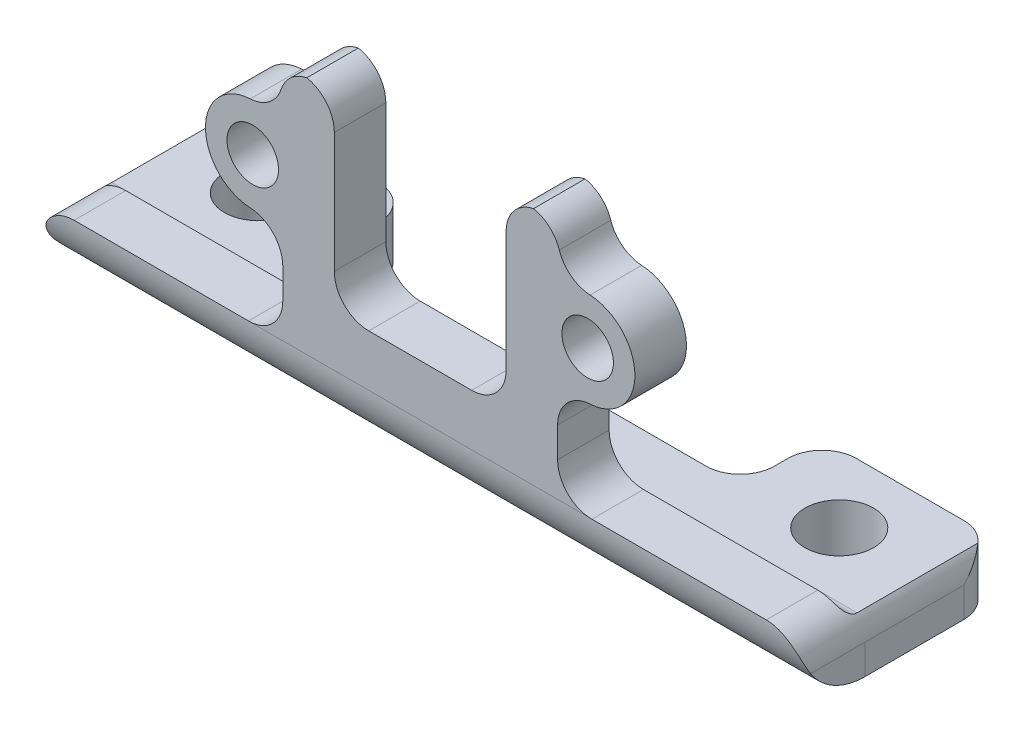
from build123d import *

# Parameters (mm, degrees)
ESBO_O23_W                     = 44.3
ESBO_O23_H                     = 11.5
ESBO_O23_R                     = 2
FLANGE_BASE2_DEPTH             = 3
ARESTA_FLANGE1_STRIP_W         = 13.4732
ARESTA_FLANGE1_STRIP_H         = 3
ARESTA_FLANGE1_STRIP_CUT_DEPTH = 44.3
ARESTA_FLANGE1_DEPTH           = 44.3
CORTE_EXTRUS_O1_REACH          = 41.939
CORTE_EXTRUS_O2_REACH          = 41.939
ESBO_O33_R                     = 1.5
ESBO_O33_W                     = 10
ESBO_O33_H                     = 11.0034
FILETE1_START                  = -5
FILETE1_DEPTH                  = 12.011168151
FILETE1_START_2                = 4.011168151
FILETE1_2_DEPTH                = 3
FILETE1_3_DEPTH                = 3
FILETE1_START_3                = -4
FILETE1_4_DEPTH                = 4.7366001
ESBO_O34_W                     = 23.8
ESBO_O34_H                     = 4.7634
CORTE_EXTRUS_O3_DEPTH          = 39.884804768
FILETE2_R                      = 2


with BuildPart() as part:
    # Flange-base2: sheet metal written as solids
    # Esboço23 → Flange-base2 (new body)
    with BuildSketch(Plane(origin=(0, 0, 0), x_dir=(1, 0, 0), z_dir=(0, 1, 0))):
        with Locations((13.143114832, -1.261168151)):
            Rectangle(ESBO_O23_W, ESBO_O23_H)
        with Locations(Location((-3.756885168, 0.488831849, 0), (0, 0, 270))):
            Circle(ESBO_O23_R, mode=Mode.SUBTRACT)
        with Locations(Location((30.043114832, 0.488831849, 0), (0, 0, 90))):
            Circle(ESBO_O23_R, mode=Mode.SUBTRACT)
    extrude(amount=-FLANGE_BASE2_DEPTH)

    # Aresta-Flange1: sheet metal written as solids
    # Aresta-Flange1 strip (on a plane across the edge) → Aresta-Flange1 strip cut (cut)
    with BuildSketch(Plane(origin=(-9.006885168, 0, 7.011168151), x_dir=(0, 0, -1), z_dir=(1, 0, 0))):
        with Locations((-3, -1.5)):
            Rectangle(ARESTA_FLANGE1_STRIP_W, ARESTA_FLANGE1_STRIP_H)
    extrude(amount=ARESTA_FLANGE1_STRIP_CUT_DEPTH, mode=Mode.SUBTRACT)

    # Aresta-Flange1 section (on a plane across the edge) → Aresta-Flange1 (add)
    with BuildSketch(Plane(origin=(-9.006885168, 0, 7.011168151), x_dir=(0, 0, -1), z_dir=(1, 0, 0))):
        with BuildLine():
            Line((0, 0.7366), (0, 14.74))
            Line((0, 14.74), (3, 14.74))
            Line((3, 14.74), (3, 0.7366))
            ThreePointArc((3, 0.7366), (3.215745145, 0.215745145), (3.7366, 0))
            Line((3.7366, 0), (3.7366, -3))
            ThreePointArc((3.7366, -3), (1.094424801, -1.905575199), (0, 0.7366))
        make_face()
    extrude(amount=ARESTA_FLANGE1_DEPTH)

    # Esboço31 → Corte-extrusão1 (cut, up to next)
    with BuildSketch(Plane.XY.offset(7.011168151), mode=Mode.PRIVATE) as corte_extrus_o1_sk1:
        with BuildLine():
            Line((5.143114832, 14.74), (5.143114832, 11.99))
            Line((5.143114832, 11.99), (3.393114832, 11.99))
            ThreePointArc((3.393114832, 11.99), (0.641414832, 9.2383), (3.393114832, 6.4866))
            Line((3.393114832, 6.4866), (5.143114832, 6.4866))
            Line((5.143114832, 6.4866), (5.143114832, 0.7366))
            Line((5.143114832, 0.7366), (-9.006885168, 0.7366))
            Line((-9.006885168, 0.7366), (-9.006885168, 14.74))
            Line((-9.006885168, 14.74), (5.143114832, 14.74))
        make_face()
    corte_extrus_o1_tool1 = extrude(corte_extrus_o1_sk1.sketch, amount=-CORTE_EXTRUS_O1_REACH, mode=Mode.PRIVATE) & part.part
    # Esboço31 → Corte-extrusão1 (cut, up to next)
    with BuildSketch(Plane.XY.offset(7.011168151), mode=Mode.PRIVATE) as corte_extrus_o1_sk2:
        with BuildLine():
            Line((21.143114832, 6.4866), (21.143114832, 0.7366))
            Line((21.143114832, 0.7366), (35.293114832, 0.7366))
            Line((35.293114832, 0.7366), (35.293114832, 14.74))
            Line((35.293114832, 14.74), (21.143114832, 14.74))
            Line((21.143114832, 14.74), (21.143114832, 11.99))
            Line((21.143114832, 11.99), (22.893114832, 11.99))
            ThreePointArc((22.893114832, 11.99), (25.644814832, 9.2383), (22.893114832, 6.4866))
            Line((22.893114832, 6.4866), (21.143114832, 6.4866))
        make_face()
    corte_extrus_o1_tool2 = extrude(corte_extrus_o1_sk2.sketch, amount=-CORTE_EXTRUS_O1_REACH, mode=Mode.PRIVATE) & part.part
    add(corte_extrus_o1_tool1.solids().sort_by_distance((-2.549902, 7.555498, 7.011168))[0], mode=Mode.SUBTRACT)
    add(corte_extrus_o1_tool2.solids().sort_by_distance((28.836132, 7.555498, 7.011168))[0], mode=Mode.SUBTRACT)

    # Esboço33 → Corte-extrusão2 (cut, up to next)
    with BuildSketch(Plane.XY.offset(7.011168151), mode=Mode.PRIVATE) as corte_extrus_o2_sk1:
        with Locations((3.393114832, 9.2383)):
            Circle(ESBO_O33_R)
    corte_extrus_o2_tool1 = extrude(corte_extrus_o2_sk1.sketch, amount=-CORTE_EXTRUS_O2_REACH, mode=Mode.PRIVATE) & part.part
    # Esboço33 → Corte-extrusão2 (cut, up to next)
    with BuildSketch(Plane.XY.offset(7.011168151), mode=Mode.PRIVATE) as corte_extrus_o2_sk2:
        with Locations(Location((22.893114832, 9.2383, 0), (0, 0, 180))):
            Circle(ESBO_O33_R)
    corte_extrus_o2_tool2 = extrude(corte_extrus_o2_sk2.sketch, amount=-CORTE_EXTRUS_O2_REACH, mode=Mode.PRIVATE) & part.part
    # Esboço33 → Corte-extrusão2 (cut, up to next)
    with BuildSketch(Plane.XY.offset(7.011168151), mode=Mode.PRIVATE) as corte_extrus_o2_sk3:
        with Locations((13.143114832, 9.2383)):
            Rectangle(ESBO_O33_W, ESBO_O33_H)
    corte_extrus_o2_tool3 = extrude(corte_extrus_o2_sk3.sketch, amount=-CORTE_EXTRUS_O2_REACH, mode=Mode.PRIVATE) & part.part
    add(corte_extrus_o2_tool1.solids().sort_by_distance((3.393115, 9.2383, 7.011168))[0], mode=Mode.SUBTRACT)
    add(corte_extrus_o2_tool2.solids().sort_by_distance((22.893115, 9.2383, 7.011168))[0], mode=Mode.SUBTRACT)
    add(corte_extrus_o2_tool3.solids().sort_by_distance((13.143115, 9.2383, 7.011168))[0], mode=Mode.SUBTRACT)

    # Filete1: read off the stored shape, not the designer's step
    # Filete1 outline → Filete1 (cut)
    with BuildSketch(Plane.XY.offset(FILETE1_START)):
        with BuildLine():
            Line((-9.006885168, 0.7366), (-9.006885168, -1.2634))
            ThreePointArc((-9.006885168, -1.2634), (-8.42109873, 0.150813562), (-7.006885168, 0.7366))
            Line((-7.006885168, 0.7366), (-9.006885168, 0.7366))
        make_face()
        with BuildLine():
            ThreePointArc((33.293114832, 0.7366), (34.707328395, 0.150813562), (35.293114832, -1.2634))
            Line((35.293114832, -1.2634), (35.293114832, 0.7366))
            Line((35.293114832, 0.7366), (33.293114832, 0.7366))
        make_face()
    extrude(amount=FILETE1_DEPTH, mode=Mode.SUBTRACT)

    # Filete1 2 outline → Filete1 2 (add)
    with BuildSketch(Plane.XY.offset(FILETE1_START_2)):
        with BuildLine():
            ThreePointArc((5.143114832, 2.7366), (4.557328394, 1.322386438), (3.143114832, 0.7366))
            Line((3.143114832, 0.7366), (5.143114832, 0.7366))
            Line((5.143114832, 0.7366), (5.143114832, 2.7366))
        make_face()
        with BuildLine():
            Line((21.143114832, 0.7366), (23.143114832, 0.7366))
            ThreePointArc((23.143114832, 0.7366), (21.72890127, 1.322386438), (21.143114832, 2.7366))
            Line((21.143114832, 2.7366), (21.143114832, 0.7366))
        make_face()
        with BuildLine():
            Line((8.143114832, 3.7366), (10.143114832, 3.7366))
            ThreePointArc((10.143114832, 3.7366), (8.72890127, 4.322386438), (8.143114832, 5.7366))
            Line((8.143114832, 5.7366), (8.143114832, 3.7366))
        make_face()
        with BuildLine():
            ThreePointArc((18.143114832, 5.7366), (17.557328394, 4.322386437), (16.143114832, 3.7366))
            Line((16.143114832, 3.7366), (18.143114832, 3.7366))
            Line((18.143114832, 3.7366), (18.143114832, 5.7366))
        make_face()
    extrude(amount=FILETE1_2_DEPTH)

    # Filete1 3 outline → Filete1 3 (add)
    with BuildSketch(Plane.XY.offset(FILETE1_START_2)):
        with BuildLine():
            ThreePointArc((22.893114832, 11.99), (22.96552716, 11.989047052), (23.037889334, 11.986188868))
            ThreePointArc((23.037889334, 11.986188868), (21.69217531, 12.606910766), (21.143114832, 13.983418849))
            Line((21.143114832, 13.983418849), (21.143114832, 11.99))
            Line((21.143114832, 11.99), (22.893114832, 11.99))
        make_face()
        with BuildLine():
            ThreePointArc((21.143114832, 4.493181151), (21.69217531, 5.869689234), (23.037889334, 6.490411131))
            ThreePointArc((23.037889334, 6.490411131), (22.96552716, 6.487552948), (22.893114832, 6.4866))
            Line((22.893114832, 6.4866), (21.143114832, 6.4866))
            Line((21.143114832, 6.4866), (21.143114832, 4.493181151))
        make_face()
        with BuildLine():
            ThreePointArc((5.143114832, 13.983418849), (4.594054355, 12.606910766), (3.248340331, 11.986188869))
            ThreePointArc((3.248340331, 11.986188869), (3.320702504, 11.989047052), (3.393114832, 11.99))
            Line((3.393114832, 11.99), (5.143114832, 11.99))
            Line((5.143114832, 11.99), (5.143114832, 13.983418849))
        make_face()
        with BuildLine():
            ThreePointArc((3.248340331, 6.490411131), (4.594054355, 5.869689234), (5.143114832, 4.493181151))
            Line((5.143114832, 4.493181151), (5.143114832, 6.4866))
            Line((5.143114832, 6.4866), (3.393114832, 6.4866))
            ThreePointArc((3.393114832, 6.4866), (3.320702504, 6.487552948), (3.248340331, 6.490411131))
        make_face()
    extrude(amount=FILETE1_3_DEPTH)

    # Filete1 4 outline → Filete1 4 (cut)
    with BuildSketch(Plane(origin=(0, 0, 0), x_dir=(1, 0, 0), z_dir=(0, 1, 0)).offset(FILETE1_START_3)):
        with BuildLine():
            Line((35.293114832, 4.488831849), (33.293114832, 4.488831849))
            ThreePointArc((33.293114832, 4.488831849), (34.707328395, 3.903045412), (35.293114832, 2.488831849))
            Line((35.293114832, 2.488831849), (35.293114832, 4.488831849))
        make_face()
        with BuildLine():
            ThreePointArc((-9.006885168, 2.488831849), (-8.421098731, 3.903045412), (-7.006885168, 4.488831849))
            Line((-7.006885168, 4.488831849), (-9.006885168, 4.488831849))
            Line((-9.006885168, 4.488831849), (-9.006885168, 2.488831849))
        make_face()
    extrude(amount=FILETE1_4_DEPTH, mode=Mode.SUBTRACT)

    # Esboço34 → Corte-extrusão3 (cut, through all)
    with BuildSketch(Plane(origin=(0, 0, 0), x_dir=(1, 0, 0), z_dir=(0, 1, 0))):
        with Locations((13.143114832, 2.107131849)):
            Rectangle(ESBO_O34_W, ESBO_O34_H)
    extrude(amount=-CORTE_EXTRUS_O3_DEPTH, mode=Mode.SUBTRACT)

    # Filete2
    # the kernel refuses this fillet: 2 mm, written as the material it adds along each edge
    with BuildSketch(Plane(origin=(1.243114832, 0, 0.274568151), x_dir=(0, 0, -1), z_dir=(0, -1, 0))) as filete2_piece_1:
        with BuildLine():
            CenterArc((FILETE2_R, FILETE2_R), FILETE2_R, 180, 90)
            Line((0, FILETE2_R), (0, 0))
            Line((0, 0), (FILETE2_R, 0))
        make_face()
    extrude(amount=3)
    with BuildSketch(Plane(origin=(25.043114832, 0, 0.274568151), x_dir=(0, 0, -1), z_dir=(0, -1, 0))) as filete2_piece_2:
        with BuildLine():
            CenterArc((FILETE2_R, -FILETE2_R), FILETE2_R, 90, 90)
            Line((0, -FILETE2_R), (0, 0))
            Line((0, 0), (FILETE2_R, 0))
        make_face()
    extrude(amount=3)
    # the kernel refuses this fillet: 2 mm, written as the material it takes off along each edge
    with BuildSketch(Plane(origin=(5.143114832, 14.74, 11.515742565), x_dir=(1, 0, 0), z_dir=(0, 0, -1))) as filete2_2_piece_1:
        with BuildLine():
            CenterArc((1.801829766, 2), FILETE2_R, 198.110746947, 71.889253053)
            Line((-0.099085117, 1.378290576), (-0.289176606, 1.316119634))
            ThreePointArc((-0.289176606, 1.316119634), (-0.2, 0.756581151), (-0.2, 0))
            Line((-0.2, 0), (0, -0.2))
            Line((0, -0.2), (1.801829766, -0.2))
            Line((1.801829766, -0.2), (1.801829766, 0))
        make_face()
    extrude(amount=12.009148828, mode=Mode.SUBTRACT)
    with BuildSketch(Plane(origin=(21.143114832, 14.74, 11.515742565), x_dir=(0.07170480855584176, -0.9974258972124044, 0), z_dir=(0, 0, -1))) as filete2_2_piece_2:
        with BuildLine():
            CenterArc((1.865651936, 1.940601288), FILETE2_R, 184.111911668, 71.889253032)
            Line((-0.129199858, 1.797191671), (-0.328685038, 1.782850709))
            Line((-0.328685038, 1.782850709), (-0.199485179, -0.014340962))
            Line((-0.199485179, -0.014340962), (0.014340962, -0.199485179))
            ThreePointArc((0.014340962, -0.199485179), (0.768974595, -0.145234673), (1.333467159, -0.194060129))
            Line((1.333467159, -0.194060129), (1.381847593, 0))
        make_face()
    extrude(amount=12.009148828, mode=Mode.SUBTRACT)
    with BuildSketch(Plane(origin=(8.143114832, 14.74, 12.011168151), x_dir=(0, -1, 0), z_dir=(0, 0, -1)), Plane(origin=(18.143114832, 14.74, 12.011168151), x_dir=(1, 0, 0), z_dir=(0, 0, -1)), Plane(origin=(25.043114832, 5, -4.488831849), x_dir=(1, 0, 0), z_dir=(0, -1, 0))) as filete2_2_piece_3:
        with BuildLine():
            CenterArc((FILETE2_R, FILETE2_R), FILETE2_R, 180, 90)
            Line((0, FILETE2_R), (0, 0))
            Line((0, 0), (FILETE2_R, 0))
        make_face()
    extrude(amount=13, mode=Mode.SUBTRACT)
    with BuildSketch(Plane(origin=(1.243114832, 5, -4.488831849), x_dir=(-1, 0, 0), z_dir=(0, -1, 0))) as filete2_2_piece_4:
        with BuildLine():
            CenterArc((FILETE2_R, -FILETE2_R), FILETE2_R, 90, 90)
            Line((0, -FILETE2_R), (0, 0))
            Line((0, 0), (FILETE2_R, 0))
        make_face()
    extrude(amount=13, mode=Mode.SUBTRACT)


solid = part.part
